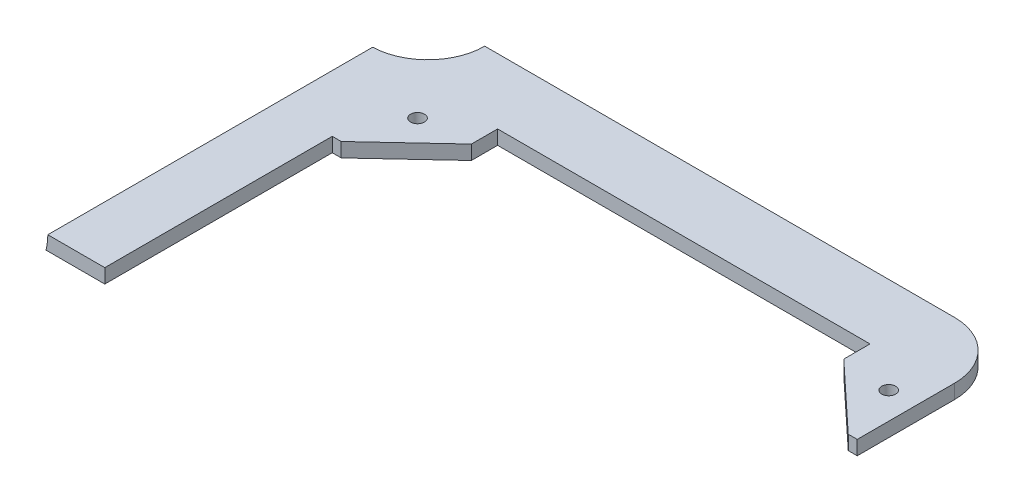
from build123d import *

# Parameters (mm, degrees)
SKETCH1_W            = 190.5
SKETCH1_H            = 76.2
BOSS_EXTRUDE1_DEPTH  = 3.175
SKETCH2_R            = 1.545336663
CUT_EXTRUDE4_DEPTH   = 103.636509708
SKETCH3_W            = 153.75
SKETCH3_H            = 3.175
BOSS_EXTRUDE2_DEPTH  = 6.35
CUT_SWEEP1_PROFILE_R = 12.7
BOSS_EXTRUDE3_START  = 2.54
BOSS_EXTRUDE3_DEPTH  = 2.54
FILLET1_R            = 12.7
CUT_EXTRUDE5_DEPTH   = 86.703968122


with BuildPart() as part:
    # Sketch1 → Boss-Extrude1 (new body)
    with BuildSketch(Plane(origin=(0, 0, 0), x_dir=(1, 0, 0), z_dir=(0, 1, 0))):
        Rectangle(SKETCH1_W, SKETCH1_H)
    extrude(amount=BOSS_EXTRUDE1_DEPTH)

    # Sketch2 → Cut-Extrude4 (cut, through all)
    with BuildSketch(Plane(origin=(0, 3.175, 0), x_dir=(1, 0, 0), z_dir=(0, 1, 0))):
        Polygon((-58.5, 12.6), (-58.5, -38.1), (95.25, -38.1), (95.25, 38.1), (58.5, 38.1), (58.5, 12.6), (56.5, 12.6), (41.5, 26.6), (41.5, 32.45), (-41.5, 32.45), (-41.5, 26.6), (-56.5, 12.6), align=None)
        with Locations((-52.505245516, 25.605245516)):
            Circle(SKETCH2_R)
        with Locations((52.5, 25.605245516)):
            Circle(SKETCH2_R)
    extrude(amount=-CUT_EXTRUDE4_DEPTH, mode=Mode.SUBTRACT)

    # Sketch3 → Boss-Extrude2 (add)
    with BuildSketch(Plane(origin=(0, 0, -38.1), x_dir=(-1, 0, 0), z_dir=(0, 0, -1))):
        with Locations((18.375, 1.5875)):
            Rectangle(SKETCH3_W, SKETCH3_H)
    extrude(amount=BOSS_EXTRUDE2_DEPTH)

    # Cut-Sweep1: sweep along a curve in space
    with BuildLine() as cut_sweep1_path:
        Line((-83.9, 3.175, 464.708912637), (-83.9, 3.175, -39.829630794))
        Line((-83.9, 3.175, -39.829630794), (-83.9, 3.175, -207.159673584))
    # Cut-Sweep1 profile (on start of the path) → Cut-Sweep1 (sweep, cut)
    with BuildSketch(Plane(origin=(-83.9, 3.175, 464.708912637), x_dir=(0, -1, 0), z_dir=(0, 0, -1))):
        Circle(CUT_SWEEP1_PROFILE_R)
    sweep(path=cut_sweep1_path.line, mode=Mode.SUBTRACT)

    # Sketch14 → Boss-Extrude3 (add)
    with BuildSketch(Plane(origin=(0, 0, -44.45), x_dir=(-1, 0, 0), z_dir=(0, 0, -1)).offset(BOSS_EXTRUDE3_START)):
        with BuildLine():
            Line((-58.5, 0), (71.603277876, 0))
            ThreePointArc((71.603277876, 0), (71.301222857, 1.574745485), (71.2, 3.175))
            Line((71.2, 3.175), (-58.5, 3.175))
            Line((-58.5, 3.175), (-58.5, 0))
        make_face()
    extrude(amount=-BOSS_EXTRUDE3_DEPTH)

    # Fillet1
    fillet1_edges = [part.edges().sort_by_distance(p)[0] for p in [
        (58.5, 1.5875, -46.99),
    ]]
    fillet(fillet1_edges, radius=FILLET1_R)

    # Sketch13 → Cut-Extrude5 (cut, through all)
    with BuildSketch(Plane(origin=(0, 0, 0), x_dir=(-1, 0, 0), z_dir=(0, -1, 0))):
        with BuildLine():
            Line((71.603277876, 46.99), (58.903277876, 46.99))
            ThreePointArc((58.903277876, 46.99), (62.623021755, 38.009743879), (71.603277876, 34.29))
            Line((71.603277876, 34.29), (71.603277876, 46.99))
        make_face()
    extrude(amount=-CUT_EXTRUDE5_DEPTH, mode=Mode.SUBTRACT)


solid = part.part
